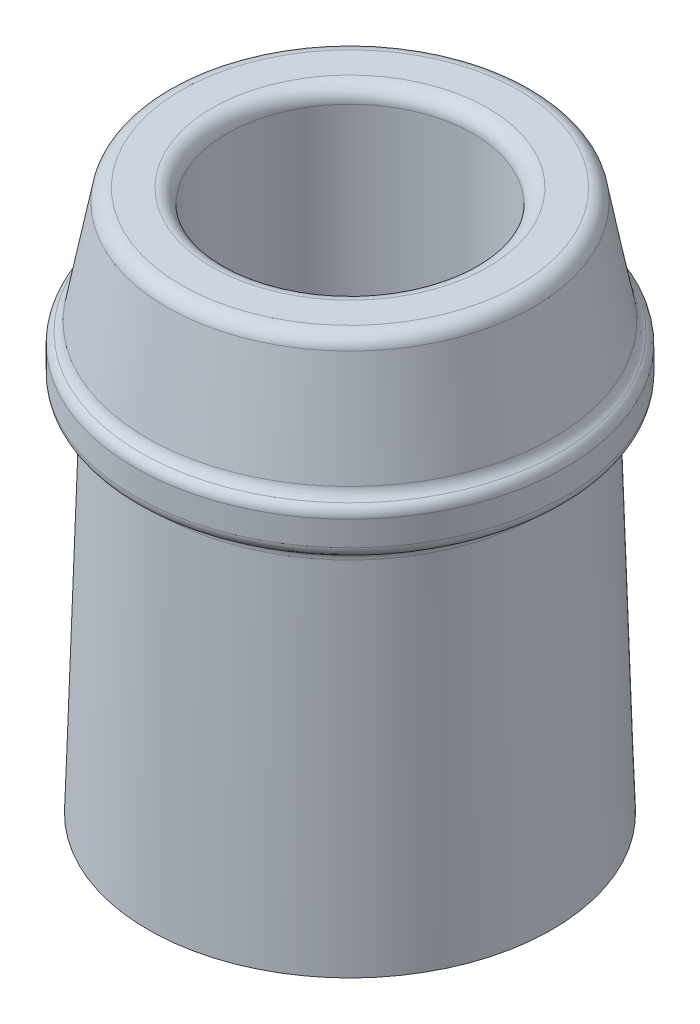
from build123d import *

# Parameters (mm, degrees)
FILLET1_R = 0.5
FILLET2_R = 0.6


with BuildPart() as part:
    # Sketch1 → Revolve1 (revolve)
    with BuildSketch(Plane.XY, mode=Mode.PRIVATE) as revolve1_sk:
        Polygon((5, 22), (5, 0), (8.2, 0), (7.75, 15), (8.725, 15), (8.725, 17), (8.3, 17), (7.35, 22), align=None)
    revolve(revolve1_sk.sketch.rotate(Axis((0, 0, 0), (0, 1, 0)), 90), axis=Axis((0, 0, 0), (0, 1, 0)))

    # Fillet1
    # the kernel refuses this fillet: 0.5 mm, written as the material it takes off along each edge
    with BuildSketch(Plane(origin=(0, 17, 0), x_dir=(0, 0, -1), z_dir=(1, 0, 0))) as fillet1_piece_1:
        with BuildLine():
            CenterArc((8.225, -0.494342998), FILLET1_R, 0, 81.373073441)
            Line((8.3, 0), (8.3015, 0.00988686))
            ThreePointArc((8.3015, 0.00988686), (8.5125, 0.01), (8.725, 0.01))
            Line((8.725, 0.01), (8.735, 0))
            Line((8.735, 0), (8.735, -0.494342998))
            Line((8.735, -0.494342998), (8.725, -0.494342998))
        make_face()
    revolve(axis=Axis((0, 17, 0), (0, 1, 0)), mode=Mode.SUBTRACT)
    with BuildSketch(Plane(origin=(0, 15, 0), x_dir=(0, 0, -1), z_dir=(1, 0, 0))) as fillet1_piece_2:
        with BuildLine():
            CenterArc((8.725 - FILLET1_R, FILLET1_R), FILLET1_R, 270, 90)
            Line((8.725, FILLET1_R), (8.725 + FILLET1_R * 0.02, FILLET1_R))
            Line((8.725 + FILLET1_R * 0.02, FILLET1_R), (8.725 + FILLET1_R * 0.02, -FILLET1_R * 0.02))
            Line((8.725 + FILLET1_R * 0.02, -FILLET1_R * 0.02), (8.725 - FILLET1_R, -FILLET1_R * 0.02))
            Line((8.725 - FILLET1_R, -FILLET1_R * 0.02), (8.725 - FILLET1_R, 0))
        make_face()
    revolve(axis=Axis((0, 15, 0), (0, 1, 0)), mode=Mode.SUBTRACT)

    # Fillet2
    fillet2_edges = [part.edges().sort_by_distance(p)[0] for p in [
        (0, 15, 7.75),
        (0, 17, 8.3),
        (0, 22, 5),
        (0, 22, 7.35),
    ]]
    fillet(fillet2_edges, radius=FILLET2_R)


solid = part.part
